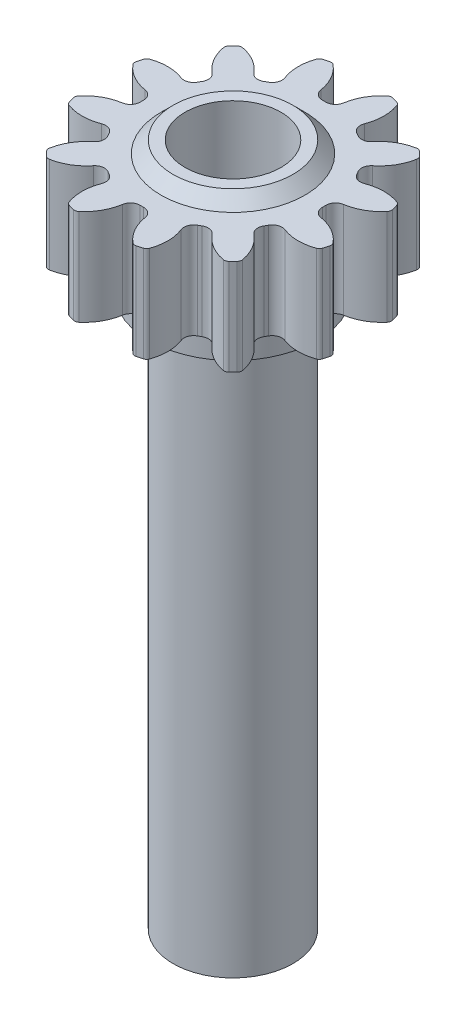
from build123d import *

# Parameters (mm, degrees)
SKETCH1_R            = 5.5
SKETCH1_R_2          = 2
BOSS_EXTRUDE1_DEPTH  = 4
CUT_EXTRUDE1_DEPTH   = 4
FILLET1_R            = 0.2
FILLET2_R            = 0.4
FILLET1_OF_MIRROR1_R = 0.2
FILLET2_OF_MIRROR1_R = 0.4
CIRPATTERN1_DEPTH    = 4
SKETCH3_R            = 3
SKETCH3_R_2          = 2
BOSS_EXTRUDE2_DEPTH  = 0.5
CHAMFER1_SIZE        = 0.5
SKETCH4_R            = 3.5
BOSS_EXTRUDE3_DEPTH  = 1
SKETCH5_R            = 2.5
BOSS_EXTRUDE4_DEPTH  = 23


# Read off the part's stored shape, not the designer's step: CirPattern1
with BuildPart() as part:
    # Sketch1 → Boss-Extrude1 (new body)
    with BuildSketch(Plane(origin=(0, 0, 0), x_dir=(1, 0, 0), z_dir=(0, 1, 0))):
        with Locations(Location((0, 0, 0), (0, 0, 270))):
            Circle(SKETCH1_R)
        with Locations(Location((0, 0, 0), (0, 0, 270))):
            Circle(SKETCH1_R_2, mode=Mode.SUBTRACT)
    extrude(amount=BOSS_EXTRUDE1_DEPTH)

    # Sketch2 → Cut-Extrude1 (cut)
    with BuildSketch(Plane(origin=(0, 4, 0), x_dir=(1, 0, 0), z_dir=(0, 1, 0))):
        with BuildLine():
            Line((0, 3.799), (0, 7.477315916))
            Line((0, 7.477315916), (-1.717756705, 5.644784223))
            ThreePointArc((-1.717756705, 5.644784223), (-0.778860554, 4.915006115), (-0.449816676, 3.772275965))
            ThreePointArc((-0.449816676, 3.772275965), (-0.225304913, 3.792313106), (0, 3.799))
        make_face()
    cut_extrude1 = extrude(amount=-CUT_EXTRUDE1_DEPTH, mode=Mode.SUBTRACT)

    # Fillet1
    fillet1_edges = [part.edges().sort_by_distance(p)[0] for p in [
        (-1.205722077, 2, -5.366212284),
    ]]
    fillet(fillet1_edges, radius=FILLET1_R)

    # Fillet2
    fillet2_edges = [part.edges().sort_by_distance(p)[0] for p in [
        (-0.449816676, 2, -3.772275965),
    ]]
    fillet(fillet2_edges, radius=FILLET2_R)

    # Mirror1: Cut-Extrude1 across plane
    add(cut_extrude1.mirror(Plane.ZY), mode=Mode.SUBTRACT)

    # Fillet1 of Mirror1
    fillet1_of_mirror1_edges = [part.edges().sort_by_distance(p)[0] for p in [
        (1.205722077, 2, -5.366212284),
    ]]
    fillet(fillet1_of_mirror1_edges, radius=FILLET1_OF_MIRROR1_R)

    # Fillet2 of Mirror1
    fillet2_of_mirror1_edges = [part.edges().sort_by_distance(p)[0] for p in [
        (0.449816676, 2, -3.772275965),
    ]]
    fillet(fillet2_of_mirror1_edges, radius=FILLET2_OF_MIRROR1_R)

    # CirPattern1 outline → CirPattern1 (cut)
    with BuildSketch(Plane(origin=(0, 0, 0), x_dir=(1, 0, 0), z_dir=(0, 1, 0))):
        with BuildLine():
            ThreePointArc((3.62556251, 4.028637884), (3.71888228, 4.023485264), (3.799671329, 3.976493152))
            ThreePointArc((3.799671329, 3.976493152), (2.75, 4.76313972), (1.543908423, 5.278858473))
            ThreePointArc((1.543908423, 5.278858473), (1.62499931, 5.23238916), (1.676121495, 5.154148179))
            ThreePointArc((1.676121495, 5.154148179), (1.787762124, 4.48460755), (1.659448371, 3.81806133))
            ThreePointArc((1.659448371, 3.81806133), (1.656771541, 3.537498856), (1.839050027, 3.32419855))
            ThreePointArc((1.839050027, 3.32419855), (1.8995, 3.290030509), (1.959315378, 3.254763317))
            ThreePointArc((1.959315378, 3.254763317), (2.235178105, 3.203555671), (2.47681392, 3.34615511))
            ThreePointArc((2.47681392, 3.34615511), (2.989903003, 3.79055119), (3.62556251, 4.028637884))
        make_face()
        with BuildLine():
            ThreePointArc((5.154148179, 1.676121495), (5.23238916, 1.62499931), (5.278858473, 1.543908423))
            ThreePointArc((5.278858473, 1.543908423), (4.763139721, 2.75), (3.976493152, 3.799671329))
            ThreePointArc((3.976493152, 3.799671329), (4.023485264, 3.71888228), (4.028637884, 3.62556251))
            ThreePointArc((4.028637884, 3.62556251), (3.79055119, 2.989903003), (3.34615511, 2.47681392))
            ThreePointArc((3.34615511, 2.47681392), (3.203555671, 2.235178105), (3.254763317, 1.959315378))
            ThreePointArc((3.254763317, 1.959315378), (3.290030509, 1.8995), (3.32419855, 1.839050027))
            ThreePointArc((3.32419855, 1.839050027), (3.537498856, 1.656771541), (3.81806133, 1.659448371))
            ThreePointArc((3.81806133, 1.659448371), (4.48460755, 1.787762124), (5.154148179, 1.676121495))
        make_face()
        with BuildLine():
            ThreePointArc((5.301684005, -1.125510295), (5.34388159, -1.208903897), (5.343579752, -1.302365321))
            ThreePointArc((5.343579752, -1.302365321), (5.5, 0), (5.343579752, 1.302365321))
            ThreePointArc((5.343579752, 1.302365321), (5.34388159, 1.208903897), (5.301684005, 1.125510295))
            ThreePointArc((5.301684005, 1.125510295), (4.777665126, 0.69405636), (4.13626229, 0.47190622))
            ThreePointArc((4.13626229, 0.47190622), (3.891949646, 0.333943185), (3.798365405, 0.069435233))
            ThreePointArc((3.798365405, 0.069435233), (3.799, 0), (3.798365405, -0.069435233))
            ThreePointArc((3.798365405, -0.069435233), (3.891949646, -0.333943185), (4.13626229, -0.47190622))
            ThreePointArc((4.13626229, -0.47190622), (4.777665126, -0.69405636), (5.301684005, -1.125510295))
        make_face()
        with BuildLine():
            ThreePointArc((4.028637884, -3.62556251), (4.023485264, -3.71888228), (3.976493152, -3.799671329))
            ThreePointArc((3.976493152, -3.799671329), (4.763139721, -2.75), (5.278858473, -1.543908423))
            ThreePointArc((5.278858473, -1.543908423), (5.23238916, -1.62499931), (5.154148179, -1.676121495))
            ThreePointArc((5.154148179, -1.676121495), (4.48460755, -1.787762124), (3.81806133, -1.659448371))
            ThreePointArc((3.81806133, -1.659448371), (3.537498856, -1.656771541), (3.32419855, -1.839050027))
            ThreePointArc((3.32419855, -1.839050027), (3.290030509, -1.8995), (3.254763317, -1.959315378))
            ThreePointArc((3.254763317, -1.959315378), (3.203555671, -2.235178105), (3.34615511, -2.47681392))
            ThreePointArc((3.34615511, -2.47681392), (3.79055119, -2.989903003), (4.028637884, -3.62556251))
        make_face()
        with BuildLine():
            ThreePointArc((1.676121495, -5.154148179), (1.62499931, -5.23238916), (1.543908423, -5.278858473))
            ThreePointArc((1.543908423, -5.278858473), (2.75, -4.763139721), (3.799671329, -3.976493152))
            ThreePointArc((3.799671329, -3.976493152), (3.71888228, -4.023485264), (3.62556251, -4.028637884))
            ThreePointArc((3.62556251, -4.028637884), (2.989903003, -3.79055119), (2.47681392, -3.34615511))
            ThreePointArc((2.47681392, -3.34615511), (2.235178105, -3.203555671), (1.959315378, -3.254763317))
            ThreePointArc((1.959315378, -3.254763317), (1.8995, -3.290030509), (1.839050027, -3.32419855))
            ThreePointArc((1.839050027, -3.32419855), (1.656771541, -3.537498856), (1.659448371, -3.81806133))
            ThreePointArc((1.659448371, -3.81806133), (1.787762124, -4.48460755), (1.676121495, -5.154148179))
        make_face()
        with BuildLine():
            ThreePointArc((-1.125510295, -5.301684005), (-1.208903897, -5.34388159), (-1.302365321, -5.343579752))
            ThreePointArc((-1.302365321, -5.343579752), (0, -5.5), (1.302365321, -5.343579752))
            ThreePointArc((1.302365321, -5.343579752), (1.208903897, -5.34388159), (1.125510295, -5.301684005))
            ThreePointArc((1.125510295, -5.301684005), (0.69405636, -4.777665126), (0.47190622, -4.13626229))
            ThreePointArc((0.47190622, -4.13626229), (0.333943185, -3.891949646), (0.069435233, -3.798365405))
            ThreePointArc((0.069435233, -3.798365405), (0, -3.799), (-0.069435233, -3.798365405))
            ThreePointArc((-0.069435233, -3.798365405), (-0.333943185, -3.891949646), (-0.47190622, -4.13626229))
            ThreePointArc((-0.47190622, -4.13626229), (-0.69405636, -4.777665126), (-1.125510295, -5.301684005))
        make_face()
        with BuildLine():
            ThreePointArc((-3.62556251, -4.028637884), (-3.71888228, -4.023485264), (-3.799671329, -3.976493152))
            ThreePointArc((-3.799671329, -3.976493152), (-2.75, -4.763139721), (-1.543908423, -5.278858473))
            ThreePointArc((-1.543908423, -5.278858473), (-1.62499931, -5.23238916), (-1.676121495, -5.154148179))
            ThreePointArc((-1.676121495, -5.154148179), (-1.787762124, -4.48460755), (-1.659448371, -3.81806133))
            ThreePointArc((-1.659448371, -3.81806133), (-1.656771541, -3.537498856), (-1.839050027, -3.32419855))
            ThreePointArc((-1.839050027, -3.32419855), (-1.8995, -3.290030509), (-1.959315378, -3.254763317))
            ThreePointArc((-1.959315378, -3.254763317), (-2.235178105, -3.203555671), (-2.47681392, -3.34615511))
            ThreePointArc((-2.47681392, -3.34615511), (-2.989903003, -3.79055119), (-3.62556251, -4.028637884))
        make_face()
        with BuildLine():
            ThreePointArc((-5.154148179, -1.676121495), (-5.23238916, -1.62499931), (-5.278858473, -1.543908423))
            ThreePointArc((-5.278858473, -1.543908423), (-4.763139721, -2.75), (-3.976493152, -3.799671329))
            ThreePointArc((-3.976493152, -3.799671329), (-4.023485264, -3.71888228), (-4.028637884, -3.62556251))
            ThreePointArc((-4.028637884, -3.62556251), (-3.79055119, -2.989903003), (-3.34615511, -2.47681392))
            ThreePointArc((-3.34615511, -2.47681392), (-3.203555671, -2.235178105), (-3.254763317, -1.959315378))
            ThreePointArc((-3.254763317, -1.959315378), (-3.290030509, -1.8995), (-3.32419855, -1.839050027))
            ThreePointArc((-3.32419855, -1.839050027), (-3.537498856, -1.656771541), (-3.81806133, -1.659448371))
            ThreePointArc((-3.81806133, -1.659448371), (-4.48460755, -1.787762124), (-5.154148179, -1.676121495))
        make_face()
        with BuildLine():
            ThreePointArc((-5.301684005, 1.125510295), (-5.34388159, 1.208903897), (-5.343579752, 1.302365321))
            ThreePointArc((-5.343579752, 1.302365321), (-5.5, 0), (-5.343579752, -1.302365321))
            ThreePointArc((-5.343579752, -1.302365321), (-5.34388159, -1.208903897), (-5.301684005, -1.125510295))
            ThreePointArc((-5.301684005, -1.125510295), (-4.777665126, -0.69405636), (-4.13626229, -0.47190622))
            ThreePointArc((-4.13626229, -0.47190622), (-3.891949646, -0.333943185), (-3.798365405, -0.069435233))
            ThreePointArc((-3.798365405, -0.069435233), (-3.799, 0), (-3.798365405, 0.069435233))
            ThreePointArc((-3.798365405, 0.069435233), (-3.891949646, 0.333943185), (-4.13626229, 0.47190622))
            ThreePointArc((-4.13626229, 0.47190622), (-4.777665126, 0.69405636), (-5.301684005, 1.125510295))
        make_face()
        with BuildLine():
            ThreePointArc((-4.028637884, 3.62556251), (-4.023485264, 3.71888228), (-3.976493152, 3.799671329))
            ThreePointArc((-3.976493152, 3.799671329), (-4.763139721, 2.75), (-5.278858473, 1.543908423))
            ThreePointArc((-5.278858473, 1.543908423), (-5.23238916, 1.62499931), (-5.154148179, 1.676121495))
            ThreePointArc((-5.154148179, 1.676121495), (-4.48460755, 1.787762124), (-3.81806133, 1.659448371))
            ThreePointArc((-3.81806133, 1.659448371), (-3.537498856, 1.656771541), (-3.32419855, 1.839050027))
            ThreePointArc((-3.32419855, 1.839050027), (-3.290030509, 1.8995), (-3.254763317, 1.959315378))
            ThreePointArc((-3.254763317, 1.959315378), (-3.203555671, 2.235178105), (-3.34615511, 2.47681392))
            ThreePointArc((-3.34615511, 2.47681392), (-3.79055119, 2.989903003), (-4.028637884, 3.62556251))
        make_face()
        with BuildLine():
            ThreePointArc((-1.959315378, 3.254763317), (-1.8995, 3.290030509), (-1.839050027, 3.32419855))
            ThreePointArc((-1.839050027, 3.32419855), (-1.656771541, 3.537498856), (-1.659448371, 3.81806133))
            ThreePointArc((-1.659448371, 3.81806133), (-1.787762124, 4.48460755), (-1.676121495, 5.154148179))
            ThreePointArc((-1.676121495, 5.154148179), (-1.62499931, 5.23238916), (-1.543908423, 5.278858473))
            ThreePointArc((-1.543908423, 5.278858473), (-2.75, 4.76313972), (-3.799671329, 3.976493152))
            ThreePointArc((-3.799671329, 3.976493152), (-3.71888228, 4.023485264), (-3.62556251, 4.028637884))
            ThreePointArc((-3.62556251, 4.028637884), (-2.989903003, 3.79055119), (-2.47681392, 3.34615511))
            ThreePointArc((-2.47681392, 3.34615511), (-2.235178105, 3.203555671), (-1.959315378, 3.254763317))
        make_face()
    extrude(amount=CIRPATTERN1_DEPTH, mode=Mode.SUBTRACT)

    # Sketch3 → Boss-Extrude2 (add)
    with BuildSketch(Plane(origin=(0, 4, 0), x_dir=(1, 0, 0), z_dir=(0, 1, 0))):
        with Locations(Location((0, 0, 0), (0, 0, 270))):
            Circle(SKETCH3_R)
        with Locations(Location((0, 0, 0), (0, 0, 270))):
            Circle(SKETCH3_R_2, mode=Mode.SUBTRACT)
    extrude(amount=BOSS_EXTRUDE2_DEPTH)

    # Chamfer1
    chamfer1_edges = [part.edges().sort_by_distance(p)[0] for p in [
        (0, 4.5, -3),
    ]]
    chamfer(chamfer1_edges, length=CHAMFER1_SIZE - 0.0001)  # a hair under: the kernel refuses the full size

    # Sketch4 → Boss-Extrude3 (add)
    with BuildSketch(Plane.XZ):
        with Locations(Location((0, 0, 0), (0, 0, 90))):
            Circle(SKETCH4_R)
    extrude(amount=BOSS_EXTRUDE3_DEPTH)

    # Sketch5 → Boss-Extrude4 (add)
    with BuildSketch(Plane.XZ.offset(1)):
        with Locations(Location((0, 0, 0), (0, 0, 270))):
            Circle(SKETCH5_R)
    extrude(amount=BOSS_EXTRUDE4_DEPTH)


solid = part.part
